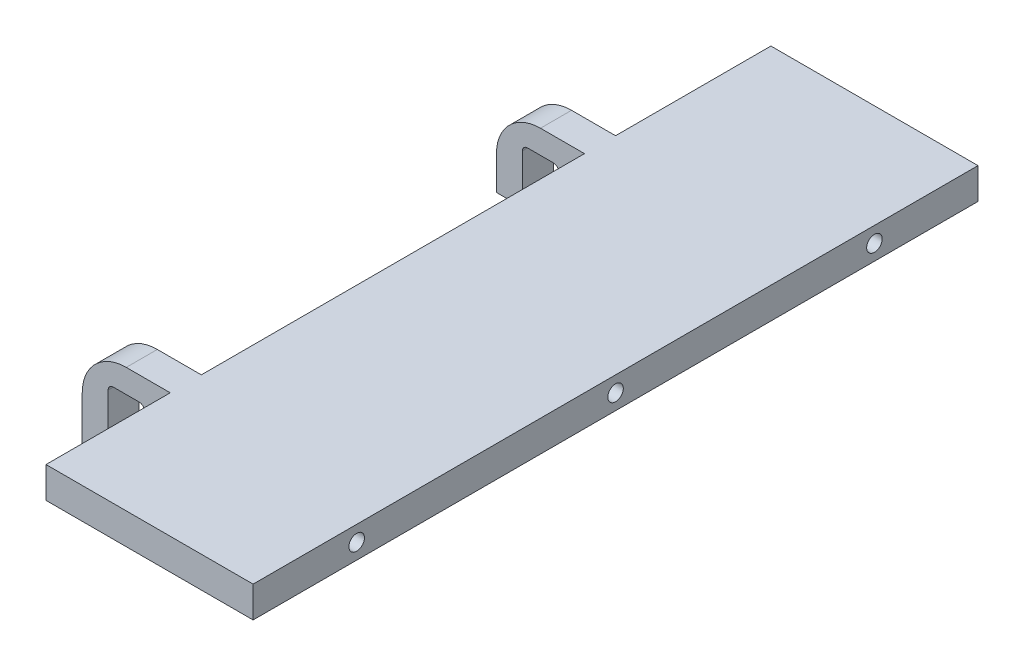
from build123d import *

# Parameters (mm, degrees)
BOSS_EXTRUDE1_DEPTH      = 3
LPATTERN1_COUNT          = 2
LPATTERN1_PITCH          = 40
SKETCH2_W                = 20
SKETCH2_H                = 70
BOSS_EXTRUDE2_DEPTH      = 3
FILLET1_R                = 3
BOSS_EXTRUDE3_DEPTH      = 3
FILLET2_START            = -1
FILLET2_DEPTH            = 5
FILLET3_DEPTH            = 3
BOSS_EXTRUDE5_REACH      = 65.784
BOSS_EXTRUDE5_END_RADIUS = 10.25
SKETCH5_R                = 1.5
LPATTERN2_START          = 7.5
LPATTERN2_OUTLINE_R      = 1.5
LPATTERN2_DEPTH          = 1.302234895
LPATTERN2_START_2        = 8.802234895
LPATTERN2_2_OUTLINE_R    = 1.5
LPATTERN2_2_DEPTH        = 2.539759791
LPATTERN2_START_3        = 39
LPATTERN2_3_DEPTH        = 5
LPATTERN2_4_OUTLINE_R    = 1.5
LPATTERN2_4_DEPTH        = 1.302235223
LPATTERN2_START_4        = 8.802235223
LPATTERN2_5_OUTLINE_R    = 1.5
LPATTERN2_5_DEPTH        = 2.539761855
LPATTERN2_6_OUTLINE_W    = 10.25
LPATTERN2_6_OUTLINE_H    = 3.000220265
LPATTERN2_6_ANGLE        = 22.115218
LPATTERN2_START_5        = 40
LPATTERN2_7_DEPTH        = 3
CUT_EXTRUDE2_DEPTH       = 64.922422006
CUT_EXTRUDE2_DEPTH_BACK  = 64.922422006
SKETCH6_W                = 3.5
SKETCH6_H                = 1.978060381
FILLET4_R                = 0.5
SKETCH7_W                = 2.5
SKETCH7_H                = 3
BOSS_EXTRUDE6_DEPTH      = 3
SKETCH8_R                = 0.75
CUT_EXTRUDE3_DEPTH       = 5
MIRROR1_START            = -4.25
MIRROR1_OUTLINE_W        = 20
MIRROR1_OUTLINE_H        = 3
MIRROR1_DEPTH            = 23.4999999
MIRROR1_START_2          = 20.75
MIRROR1_2_OUTLINE_W      = 20
MIRROR1_2_OUTLINE_H      = 3
MIRROR1_2_DEPTH          = 23.4999999
MIRROR1_START_3          = 45.75
MIRROR1_3_OUTLINE_W      = 20
MIRROR1_3_OUTLINE_H      = 3
MIRROR1_3_DEPTH          = 9.25
MIRROR1_START_4          = -15
MIRROR1_4_OUTLINE_W      = 20
MIRROR1_4_OUTLINE_H      = 3
MIRROR1_4_DEPTH          = 9.2499999
MIRROR1_START_5          = 40
MIRROR1_5_DEPTH          = 3
MIRROR1_6_DEPTH          = 3
MIRROR1_START_6          = 11
MIRROR1_7_OUTLINE_W      = 3
MIRROR1_7_OUTLINE_H      = 1.5000001
MIRROR1_7_DEPTH          = 15
MIRROR1_START_7          = 26
MIRROR1_8_DEPTH          = 5
MIRROR1_START_8          = 7.5
MIRROR1_9_OUTLINE_R      = 1.5
MIRROR1_9_DEPTH          = 1.302234895
MIRROR1_START_9          = 8.802234895
MIRROR1_10_OUTLINE_R     = 1.5
MIRROR1_10_DEPTH         = 2.539759791
MIRROR1_START_10         = -1
MIRROR1_11_DEPTH         = 5
MIRROR1_12_OUTLINE_R     = 1.5
MIRROR1_12_DEPTH         = 1.302235223
MIRROR1_START_11         = 8.802235223
MIRROR1_13_OUTLINE_R     = 1.5
MIRROR1_13_DEPTH         = 2.539761855
MIRROR1_14_OUTLINE_W     = 10.25
MIRROR1_14_OUTLINE_H     = 3.000220265
MIRROR1_14_ANGLE         = 22.115218
MIRROR1_15_DEPTH         = 3
MIRROR1_16_OUTLINE_R     = 1.5
MIRROR1_16_DEPTH         = 1.302234895
MIRROR1_17_OUTLINE_R     = 1.5
MIRROR1_17_DEPTH         = 2.539759791
MIRROR1_START_12         = 39
MIRROR1_18_DEPTH         = 5
MIRROR1_19_DEPTH         = 3
MIRROR1_20_OUTLINE_R     = 1.5
MIRROR1_20_DEPTH         = 1.302235223
MIRROR1_21_OUTLINE_R     = 1.5
MIRROR1_21_DEPTH         = 2.539761855
MIRROR1_22_OUTLINE_W     = 10.25
MIRROR1_22_OUTLINE_H     = 3.000220265
MIRROR1_22_ANGLE         = 22.115218
CUT_EXTRUDE4_DEPTH       = 82.052921206
CUT_EXTRUDE4_DEPTH_BACK  = 82.052921206
SKETCH9_W                = 31.619894417
SKETCH9_H                = 19.739229587


with BuildPart() as part:
    # Sketch1 → Boss-Extrude1 (new body)
    with BuildSketch(Plane.XY):
        with BuildLine():
            Line((0, 3.25), (0, 0))
            Line((0, 0), (2.5, 0))
            Line((2.5, 0), (2.5, 3.25))
            ThreePointArc((2.5, 3.25), (1.25520382, 6.25520382), (-1.75, 7.5))
            Line((-1.75, 7.5), (-6, 7.5))
            Line((-6, 7.5), (-6, 3.25))
            Line((-6, 3.25), (-6, 0))
            Line((-6, 0), (-3.5, 0))
            Line((-3.5, 0), (-3.5, 3.25))
            ThreePointArc((-3.5, 3.25), (-1.75, 5), (0, 3.25))
        make_face()
    extrude(amount=BOSS_EXTRUDE1_DEPTH)


with BuildPart() as lpattern1_1:
    # LPattern1: pattern copy
    add(part.part.moved(Location(Vector(0, 0, 1) * (1 * LPATTERN1_PITCH))))


with BuildPart() as part_1:
    add(part.part)

    add(lpattern1_1.part)  # Boss-Extrude2 merges LPattern1_1
    # Sketch2 → Boss-Extrude2 (add)
    with BuildSketch(Plane(origin=(0, 7.5, 0), x_dir=(1, 0, 0), z_dir=(0, 1, 0))):
        with Locations((-16, -20)):
            Rectangle(SKETCH2_W, SKETCH2_H)
    extrude(amount=-BOSS_EXTRUDE2_DEPTH)

    # Fillet1
    fillet1_edges = [part_1.edges().sort_by_distance(p)[0] for p in [
        (-6, 4.5, 1.5),
        (-6, 4.5, 41.5),
    ]]
    fillet(fillet1_edges, radius=FILLET1_R)

    # Sketch6 → Cut-Extrude2 (cut, two sides: drawn at the far end of the back side and taken through both)
    with BuildSketch(Plane.XY.offset(3).offset(-CUT_EXTRUDE2_DEPTH_BACK)):
        with Locations((-1.75, 4.239030191)):
            Rectangle(SKETCH6_W, SKETCH6_H)
    extrude(amount=CUT_EXTRUDE2_DEPTH + CUT_EXTRUDE2_DEPTH_BACK, mode=Mode.SUBTRACT)

    # Fillet4
    fillet4_edges = [part_1.edges().sort_by_distance(p)[0] for p in [
        (-3.5, 5.228060381, 1.5),
        (-3.5, 5.228060381, 41.5),
        (0, 5.228060381, 1.5),
        (0, 5.228060381, 41.5),
    ]]
    fillet(fillet4_edges, radius=FILLET4_R)

    # Sketch7 → Boss-Extrude6 (add)
    with BuildSketch(Plane.XY.offset(43)):
        with Locations((1.25, -1.5)):
            Rectangle(SKETCH7_W, SKETCH7_H)
    extrude(amount=-BOSS_EXTRUDE6_DEPTH)

    # Sketch8 → Cut-Extrude3 (cut)
    with BuildSketch(Plane.ZY.offset(26)):
        with Locations((-5, 6)):
            Circle(SKETCH8_R)
        with Locations((20, 6)):
            Circle(SKETCH8_R)
        with Locations((45, 6)):
            Circle(SKETCH8_R)
    extrude(amount=-CUT_EXTRUDE3_DEPTH, mode=Mode.SUBTRACT)


with BuildPart() as body_2:
    # Sketch4 → Boss-Extrude3 (new body)
    with BuildSketch(Plane.XY.offset(3)):
        with BuildLine():
            Line((-20.857798696, 25.621740076), (-21.206324936, 26.579308051))
            ThreePointArc((-21.206324936, 26.579308051), (-16.672163531, 7.522062955), (-9.682947675, 25.822010278))
            Line((-9.682947675, 25.822010278), (-10.11803023, 24.888972729))
            ThreePointArc((-10.11803023, 24.888972729), (-16.629657521, 8.521455618), (-20.857798696, 25.621740076))
        make_face()
    extrude(amount=-BOSS_EXTRUDE3_DEPTH)

    # Fillet2: read off the stored shape, not the designer's step
    # Fillet2 outline → Fillet2 (cut)
    with BuildSketch(Plane.XY.offset(FILLET2_START)):
        with BuildLine():
            add(Edge.make_bspline(
                [(-20.994076432, 25.996160077), (-21.074153595, 26.216170321), (-21.251523965, 26.350710286), (-21.454646821, 26.373043505), (-21.624101617, 26.320471493), (-21.744123922, 26.239260296)],
                knots=[0.438237279, 0.438237279, 0.438237279, 0.438237279, 0.438237279, 0.438237279, 1, 1, 1, 1, 1, 1], degree=5, weights=[0.507629267, 0.479872472, 0.515231147, 0.613705294, 0.775294911, 1]))
            Line((-20.994076432, 25.996160077), (-21.206324936, 26.579308051))
            ThreePointArc((-21.206324936, 26.579308051), (-21.477863695, 26.413458278), (-21.744123922, 26.239260296))
        make_face()
        with BuildLine():
            add(Edge.make_bspline(
                [(-21.183721588, 25.411039779), (-21.095700521, 25.470597844), (-21.011417818, 25.561339411), (-20.949957611, 25.687250869), (-20.937439038, 25.840550084), (-20.994076432, 25.996160077)],
                knots=[0, 0, 0, 0, 0, 0, 0.438237279, 0.438237279, 0.438237279, 0.438237279, 0.438237279, 0.438237279], degree=5, weights=[1, 0.824705088, 0.687820559, 0.589346413, 0.529282649, 0.507629267]))
            ThreePointArc((-21.183721588, 25.411039779), (-21.021865296, 25.518099442), (-20.857798696, 25.621740076))
            Line((-20.857798696, 25.621740076), (-20.994076432, 25.996160077))
        make_face()
    extrude(amount=FILLET2_DEPTH, mode=Mode.SUBTRACT)

    # Fillet3: read off the stored shape, not the designer's step
    # Fillet3 outline → Fillet3 (cut)
    with BuildSketch(Plane.XY):
        with BuildLine():
            add(Edge.make_bspline(
                [(-9.171518011, 25.394235327), (-9.282578146, 25.493443697), (-9.44922289, 25.569577268), (-9.660410728, 25.570842005), (-9.856114015, 25.450653826), (-9.957768573, 25.23265496)],
                knots=[0, 0, 0, 0, 0, 0, 0.573717386, 0.573717386, 0.573717386, 0.573717386, 0.573717386, 0.573717386], degree=5, weights=[1, 0.770513046, 0.606856419, 0.50903012, 0.477034149, 0.510868506]))
            ThreePointArc((-9.171518011, 25.394235327), (-9.423753658, 25.612282369), (-9.682947675, 25.822010278))
            Line((-9.682947675, 25.822010278), (-9.957768573, 25.23265496))
        make_face()
        with BuildLine():
            add(Edge.make_bspline(
                [(-9.957768573, 25.23265496), (-10.024989519, 25.088499201), (-10.028130695, 24.940896848), (-9.983698166, 24.813907164), (-9.914364214, 24.716929113), (-9.837711376, 24.648456271)],
                knots=[0.573717386, 0.573717386, 0.573717386, 0.573717386, 0.573717386, 0.573717386, 1, 1, 1, 1, 1, 1], degree=5, weights=[0.510868506, 0.536008058, 0.597490983, 0.695317282, 0.829486954, 1]))
            Line((-9.957768573, 25.23265496), (-10.11803023, 24.888972729))
            ThreePointArc((-10.11803023, 24.888972729), (-9.976670181, 24.770113809), (-9.837711376, 24.648456271))
        make_face()
    extrude(amount=FILLET3_DEPTH, mode=Mode.SUBTRACT)


with BuildPart() as body_3:
    # Boss-Extrude5: up to this cylinder (the profile starts outside it)
    boss_extrude5_end = Plane(origin=(-16, 17.75, 1.5), z_dir=(0, 0, 1)) * Cylinder(BOSS_EXTRUDE5_END_RADIUS, 153.068, mode=Mode.PRIVATE)
    # Sketch5 → Boss-Extrude5 (new, up to the surface)
    with BuildSketch(Plane(origin=(0, 7.5, 0), x_dir=(1, 0, 0), z_dir=(0, 1, 0)), mode=Mode.PRIVATE) as boss_extrude5_sk1:
        with Locations(Location((-22.5, -1.5, 0), (0, 0, 90))):
            Circle(SKETCH5_R)
    boss_extrude5_tool1 = extrude(boss_extrude5_sk1.sketch, amount=BOSS_EXTRUDE5_REACH, mode=Mode.PRIVATE) - boss_extrude5_end
    add(boss_extrude5_tool1.solids().sort_by_distance((-22.5, 7.5, 1.5))[0])
    # Sketch5 → Boss-Extrude5 (new, up to the surface)
    with BuildSketch(Plane(origin=(0, 7.5, 0), x_dir=(1, 0, 0), z_dir=(0, 1, 0)), mode=Mode.PRIVATE) as boss_extrude5_sk2:
        with Locations(Location((-9.5, -1.5, 0), (0, 0, 90))):
            Circle(SKETCH5_R)
    boss_extrude5_tool2 = extrude(boss_extrude5_sk2.sketch, amount=BOSS_EXTRUDE5_REACH, mode=Mode.PRIVATE) - boss_extrude5_end
    add(boss_extrude5_tool2.solids().sort_by_distance((-9.5, 7.5, 1.5))[0])


with BuildPart() as body_4:
    # LPattern2: read off the stored shape, not the designer's step
    # LPattern2 outline → LPattern2 (new body)
    with BuildSketch(Plane(origin=(0, 0, 0), x_dir=(1, 0, 0), z_dir=(0, 1, 0)).offset(LPATTERN2_START)):
        with Locations((-22.5, -41.5)):
            Circle(LPATTERN2_OUTLINE_R)
    extrude(amount=LPATTERN2_DEPTH)

    # LPattern2 2 outline → LPattern2 2 (add)
    with BuildSketch(Plane(origin=(0, 0, 0), x_dir=(1, 0, 0), z_dir=(0, 1, 0)).offset(LPATTERN2_START_2)):
        with Locations((-22.5, -41.5)):
            Circle(LPATTERN2_2_OUTLINE_R)
    extrude(amount=LPATTERN2_2_DEPTH)

    # LPattern2 3 outline → LPattern2 3 (cut)
    with BuildSketch(Plane.XY.offset(LPATTERN2_START_3)):
        with BuildLine():
            Line((-20, 11.341994686), (-23.999998778, 11.341995665))
            ThreePointArc((-23.999998778, 11.341995665), (-22.622702211, 9.926809128), (-20.999584885, 8.802002963))
            Line((-20.999584885, 8.802002963), (-20, 8.243497024))
            Line((-20, 8.243497024), (-20, 11.341994686))
        make_face()
    extrude(amount=LPATTERN2_3_DEPTH, mode=Mode.SUBTRACT)


with BuildPart() as body_5:
    # LPattern2 4 outline → LPattern2 4 (new body)
    with BuildSketch(Plane(origin=(0, 0, 0), x_dir=(1, 0, 0), z_dir=(0, 1, 0)).offset(LPATTERN2_START)):
        with Locations((-9.5, -41.5)):
            Circle(LPATTERN2_4_OUTLINE_R)
    extrude(amount=LPATTERN2_4_DEPTH)

    # LPattern2 5 outline → LPattern2 5 (add)
    with BuildSketch(Plane(origin=(0, 0, 0), x_dir=(1, 0, 0), z_dir=(0, 1, 0)).offset(LPATTERN2_START_4)):
        with Locations((-9.5, -41.5)):
            Circle(LPATTERN2_5_OUTLINE_R)
    extrude(amount=LPATTERN2_5_DEPTH)

    # LPattern2 6 outline → LPattern2 6 (revolve, cut)
    with BuildSketch(Plane(origin=(-16, 17.75, 0), x_dir=(0.4877650283417417, -0.8729749579035929, 0), z_dir=(-0.8729749579035929, -0.4877650283417417, 0))):
        with Locations((5.125, 41.500109978)):
            Rectangle(LPATTERN2_6_OUTLINE_W, LPATTERN2_6_OUTLINE_H)
    revolve(axis=Axis((-16, 17.75, 0), (0, 0, 1)), revolution_arc=LPATTERN2_6_ANGLE, mode=Mode.SUBTRACT)


with BuildPart() as body_6:
    # LPattern2 7 outline → LPattern2 7 (new body)
    with BuildSketch(Plane.XY.offset(LPATTERN2_START_5)):
        with BuildLine():
            ThreePointArc((-21.744123922, 26.239260296), (-16.687368099, 7.523073526), (-9.171518011, 25.394235327))
            add(Edge.make_bspline(
                [(-9.171518011, 25.394235327), (-9.42011103, 25.616299782), (-9.897400645, 25.707435586), (-10.230497327, 25.334546058), (-10.086304395, 24.870520725), (-9.837711376, 24.648456271)],
                knots=[0, 0, 0, 0, 0, 0, 1, 1, 1, 1, 1, 1], degree=5, weights=[1, 0.6, 0.4, 0.4, 0.6, 1]))
            ThreePointArc((-9.837711376, 24.648456271), (-16.620307797, 8.520822451), (-21.183721588, 25.41103978))
            add(Edge.make_bspline(
                [(-21.183721588, 25.41103978), (-20.907648082, 25.597840557), (-20.702656783, 26.038396659), (-20.98285795, 26.452506918), (-21.468050416, 26.426061074), (-21.744123922, 26.239260296)],
                knots=[0, 0, 0, 0, 0, 0, 1, 1, 1, 1, 1, 1], degree=5, weights=[1, 0.6, 0.4, 0.4, 0.6, 1]))
        make_face()
    extrude(amount=LPATTERN2_7_DEPTH)


with BuildPart() as body_7:
    # Mirror1: read off the stored shape, not the designer's step
    # Mirror1 outline → Mirror1 (new body)
    with BuildSketch(Plane.XY.offset(MIRROR1_START)):
        with Locations((21, 6)):
            Rectangle(MIRROR1_OUTLINE_W, MIRROR1_OUTLINE_H)
    extrude(amount=MIRROR1_DEPTH)

    # Mirror1 2 outline → Mirror1 2 (add)
    with BuildSketch(Plane.XY.offset(MIRROR1_START_2)):
        with Locations((21, 6)):
            Rectangle(MIRROR1_2_OUTLINE_W, MIRROR1_2_OUTLINE_H)
    extrude(amount=MIRROR1_2_DEPTH)

    # Mirror1 3 outline → Mirror1 3 (add)
    with BuildSketch(Plane.XY.offset(MIRROR1_START_3)):
        with Locations((21, 6)):
            Rectangle(MIRROR1_3_OUTLINE_W, MIRROR1_3_OUTLINE_H)
    extrude(amount=MIRROR1_3_DEPTH)

    # Mirror1 4 outline → Mirror1 4 (add)
    with BuildSketch(Plane.XY.offset(MIRROR1_START_4)):
        with Locations((21, 6)):
            Rectangle(MIRROR1_4_OUTLINE_W, MIRROR1_4_OUTLINE_H)
    extrude(amount=MIRROR1_4_DEPTH)

    # Mirror1 5 outline → Mirror1 5 (add)
    with BuildSketch(Plane.XY.offset(MIRROR1_START_5)):
        with BuildLine():
            Line((11, 4.5), (11, 7.5))
            Line((11, 7.5), (6.75, 7.5))
            ThreePointArc((6.75, 7.5), (3.74479618, 6.25520382), (2.5, 3.25))
            Line((2.5, 3.25), (2.5, -3))
            Line((2.5, -3), (5, -3))
            Line((5, -3), (5, 4.728060381))
            ThreePointArc((5, 4.728060381), (5.146446609, 5.081613772), (5.5, 5.228060381))
            Line((5.5, 5.228060381), (8, 5.228060381))
            ThreePointArc((8, 5.228060381), (8.353553391, 5.081613772), (8.5, 4.728060381))
            Line((8.5, 4.728060381), (8.5, 0))
            Line((8.5, 0), (11, 0))
            Line((11, 0), (11, 1.5))
            ThreePointArc((11, 1.5), (11.878679656, 3.621320344), (14, 4.5))
            Line((14, 4.5), (11, 4.5))
        make_face()
    extrude(amount=MIRROR1_5_DEPTH)

    # Mirror1 6 outline → Mirror1 6 (add)
    with BuildSketch(Plane.XY):
        with BuildLine():
            Line((11, 4.5), (11, 7.5))
            Line((11, 7.5), (6.75, 7.5))
            ThreePointArc((6.75, 7.5), (3.74479618, 6.25520382), (2.5, 3.25))
            Line((2.5, 3.25), (2.5, 0))
            Line((2.5, 0), (5, 0))
            Line((5, 0), (5, 4.728060381))
            ThreePointArc((5, 4.728060381), (5.146446609, 5.081613772), (5.5, 5.228060381))
            Line((5.5, 5.228060381), (8, 5.228060381))
            ThreePointArc((8, 5.228060381), (8.353553391, 5.081613772), (8.5, 4.728060381))
            Line((8.5, 4.728060381), (8.5, 0))
            Line((8.5, 0), (11, 0))
            Line((11, 0), (11, 1.5))
            ThreePointArc((11, 1.5), (11.878679656, 3.621320344), (14, 4.5))
            Line((14, 4.5), (11, 4.5))
        make_face()
    extrude(amount=MIRROR1_6_DEPTH)

    # Mirror1 7 outline → Mirror1 7 (add)
    with BuildSketch(Plane.YZ.offset(MIRROR1_START_6)):
        with Locations((6, -5.00000005)):
            Rectangle(MIRROR1_7_OUTLINE_W, MIRROR1_7_OUTLINE_H)
        with Locations((6, 19.99999995)):
            Rectangle(MIRROR1_7_OUTLINE_W, MIRROR1_7_OUTLINE_H)
        with Locations((6, 44.99999995)):
            Rectangle(MIRROR1_7_OUTLINE_W, MIRROR1_7_OUTLINE_H)
    extrude(amount=MIRROR1_7_DEPTH)

    # Mirror1 8 outline → Mirror1 8 (add)
    with BuildSketch(Plane.YZ.offset(MIRROR1_START_7)):
        with BuildLine():
            Line((6, -5.75), (7.5, -5.7500001))
            Line((7.5, -5.7500001), (7.5, -4.25))
            Line((7.5, -4.25), (6, -4.25))
            ThreePointArc((6, -4.25), (6.75, -5), (6, -5.75))
        make_face()
        with BuildLine():
            Line((4.5, -5.7500001), (6, -5.75))
            ThreePointArc((6, -5.75), (5.25, -5), (6, -4.25))
            Line((6, -4.25), (4.5, -4.25))
            Line((4.5, -4.25), (4.5, -5.7500001))
        make_face()
        with BuildLine():
            Line((6, 19.25), (7.5, 19.2499999))
            Line((7.5, 19.2499999), (7.5, 20.75))
            Line((7.5, 20.75), (6, 20.75))
            ThreePointArc((6, 20.75), (6.75, 20), (6, 19.25))
        make_face()
        with BuildLine():
            Line((4.5, 19.2499999), (6, 19.25))
            ThreePointArc((6, 19.25), (5.25, 20), (6, 20.75))
            Line((6, 20.75), (4.5, 20.75))
            Line((4.5, 20.75), (4.5, 19.2499999))
        make_face()
        with BuildLine():
            Line((6, 44.25), (7.5, 44.2499999))
            Line((7.5, 44.2499999), (7.5, 45.75))
            Line((7.5, 45.75), (6, 45.75))
            ThreePointArc((6, 45.75), (6.75, 45), (6, 44.25))
        make_face()
        with BuildLine():
            Line((4.5, 44.2499999), (6, 44.25))
            ThreePointArc((6, 44.25), (5.25, 45), (6, 45.75))
            Line((6, 45.75), (4.5, 45.75))
            Line((4.5, 45.75), (4.5, 44.2499999))
        make_face()
    extrude(amount=MIRROR1_8_DEPTH)


with BuildPart() as body_8:
    # Mirror1 9 outline → Mirror1 9 (new body)
    with BuildSketch(Plane(origin=(0, 0, 0), x_dir=(1, 0, 0), z_dir=(0, 1, 0)).offset(MIRROR1_START_8)):
        with Locations((27.5, -1.5)):
            Circle(MIRROR1_9_OUTLINE_R)
    extrude(amount=MIRROR1_9_DEPTH)

    # Mirror1 10 outline → Mirror1 10 (add)
    with BuildSketch(Plane(origin=(0, 0, 0), x_dir=(1, 0, 0), z_dir=(0, 1, 0)).offset(MIRROR1_START_9)):
        with Locations((27.5, -1.5)):
            Circle(MIRROR1_10_OUTLINE_R)
    extrude(amount=MIRROR1_10_DEPTH)

    # Mirror1 11 outline → Mirror1 11 (cut)
    with BuildSketch(Plane.XY.offset(MIRROR1_START_10)):
        with BuildLine():
            Line((25, 8.243497024), (25.999584885, 8.802002963))
            ThreePointArc((25.999584885, 8.802002963), (27.622702211, 9.926809128), (28.999998778, 11.341995665))
            Line((28.999998778, 11.341995665), (25, 11.341994686))
            Line((25, 11.341994686), (25, 8.243497024))
        make_face()
    extrude(amount=MIRROR1_11_DEPTH, mode=Mode.SUBTRACT)


with BuildPart() as body_9:
    # Mirror1 12 outline → Mirror1 12 (new body)
    with BuildSketch(Plane(origin=(0, 0, 0), x_dir=(1, 0, 0), z_dir=(0, 1, 0)).offset(MIRROR1_START_8)):
        with Locations((14.5, -41.5)):
            Circle(MIRROR1_12_OUTLINE_R)
    extrude(amount=MIRROR1_12_DEPTH)

    # Mirror1 13 outline → Mirror1 13 (add)
    with BuildSketch(Plane(origin=(0, 0, 0), x_dir=(1, 0, 0), z_dir=(0, 1, 0)).offset(MIRROR1_START_11)):
        with Locations((14.5, -41.5)):
            Circle(MIRROR1_13_OUTLINE_R)
    extrude(amount=MIRROR1_13_DEPTH)

    # Mirror1 14 outline → Mirror1 14 (revolve, cut)
    with BuildSketch(Plane(origin=(21, 17.75, 0), x_dir=(-0.7805286813468162, -0.6251199705616516, 0), z_dir=(-0.6251199705616516, 0.7805286813468162, 0))):
        with Locations((5.125, 41.500109978)):
            Rectangle(MIRROR1_14_OUTLINE_W, MIRROR1_14_OUTLINE_H)
    revolve(axis=Axis((21, 17.75, 0), (0, 0, 1)), revolution_arc=MIRROR1_14_ANGLE, mode=Mode.SUBTRACT)


with BuildPart() as body_10:
    # Mirror1 15 outline → Mirror1 15 (new body)
    with BuildSketch(Plane.XY.offset(MIRROR1_START_5)):
        with BuildLine():
            add(Edge.make_bspline(
                [(14.171518011, 25.394235327), (14.42011103, 25.616299782), (14.897400645, 25.707435586), (15.230497327, 25.334546058), (15.086304395, 24.870520725), (14.837711376, 24.648456271)],
                knots=[0, 0, 0, 0, 0, 0, 1, 1, 1, 1, 1, 1], degree=5, weights=[1, 0.6, 0.4, 0.4, 0.6, 1]))
            ThreePointArc((14.171518011, 25.394235327), (21.687368099, 7.523073526), (26.744123922, 26.239260296))
            add(Edge.make_bspline(
                [(26.183721588, 25.411039779), (25.907648082, 25.597840557), (25.702656783, 26.038396659), (25.98285795, 26.452506918), (26.468050416, 26.426061074), (26.744123922, 26.239260296)],
                knots=[0, 0, 0, 0, 0, 0, 1, 1, 1, 1, 1, 1], degree=5, weights=[1, 0.6, 0.4, 0.4, 0.6, 1]))
            ThreePointArc((26.183721588, 25.411039779), (21.620307797, 8.520822451), (14.837711376, 24.648456271))
        make_face()
    extrude(amount=MIRROR1_15_DEPTH)


with BuildPart() as body_11:
    # Mirror1 16 outline → Mirror1 16 (new body)
    with BuildSketch(Plane(origin=(0, 0, 0), x_dir=(1, 0, 0), z_dir=(0, 1, 0)).offset(MIRROR1_START_8)):
        with Locations((27.5, -41.5)):
            Circle(MIRROR1_16_OUTLINE_R)
    extrude(amount=MIRROR1_16_DEPTH)

    # Mirror1 17 outline → Mirror1 17 (add)
    with BuildSketch(Plane(origin=(0, 0, 0), x_dir=(1, 0, 0), z_dir=(0, 1, 0)).offset(MIRROR1_START_9)):
        with Locations((27.5, -41.5)):
            Circle(MIRROR1_17_OUTLINE_R)
    extrude(amount=MIRROR1_17_DEPTH)

    # Mirror1 18 outline → Mirror1 18 (cut)
    with BuildSketch(Plane.XY.offset(MIRROR1_START_12)):
        with BuildLine():
            Line((25, 8.243497024), (25.999584885, 8.802002963))
            ThreePointArc((25.999584885, 8.802002963), (27.622702211, 9.926809128), (28.999998778, 11.341995665))
            Line((28.999998778, 11.341995665), (25, 11.341994686))
            Line((25, 11.341994686), (25, 8.243497024))
        make_face()
    extrude(amount=MIRROR1_18_DEPTH, mode=Mode.SUBTRACT)


with BuildPart() as body_12:
    # Mirror1 19 outline → Mirror1 19 (new body)
    with BuildSketch(Plane.XY):
        with BuildLine():
            add(Edge.make_bspline(
                [(14.171518011, 25.394235327), (14.42011103, 25.616299782), (14.897400645, 25.707435586), (15.230497327, 25.334546058), (15.086304395, 24.870520725), (14.837711376, 24.648456271)],
                knots=[0, 0, 0, 0, 0, 0, 1, 1, 1, 1, 1, 1], degree=5, weights=[1, 0.6, 0.4, 0.4, 0.6, 1]))
            ThreePointArc((14.171518011, 25.394235327), (21.687368099, 7.523073526), (26.744123922, 26.239260296))
            add(Edge.make_bspline(
                [(26.183721588, 25.411039779), (25.907648082, 25.597840557), (25.702656783, 26.038396659), (25.98285795, 26.452506918), (26.468050416, 26.426061074), (26.744123922, 26.239260296)],
                knots=[0, 0, 0, 0, 0, 0, 1, 1, 1, 1, 1, 1], degree=5, weights=[1, 0.6, 0.4, 0.4, 0.6, 1]))
            ThreePointArc((26.183721588, 25.411039779), (21.620307797, 8.520822451), (14.837711376, 24.648456271))
        make_face()
    extrude(amount=MIRROR1_19_DEPTH)


with BuildPart() as body_13:
    # Mirror1 20 outline → Mirror1 20 (new body)
    with BuildSketch(Plane(origin=(0, 0, 0), x_dir=(1, 0, 0), z_dir=(0, 1, 0)).offset(MIRROR1_START_8)):
        with Locations((14.5, -1.5)):
            Circle(MIRROR1_20_OUTLINE_R)
    extrude(amount=MIRROR1_20_DEPTH)

    # Mirror1 21 outline → Mirror1 21 (add)
    with BuildSketch(Plane(origin=(0, 0, 0), x_dir=(1, 0, 0), z_dir=(0, 1, 0)).offset(MIRROR1_START_11)):
        with Locations((14.5, -1.5)):
            Circle(MIRROR1_21_OUTLINE_R)
    extrude(amount=MIRROR1_21_DEPTH)

    # Mirror1 22 outline → Mirror1 22 (revolve, cut)
    with BuildSketch(Plane(origin=(21, 17.75, 0), x_dir=(-0.7805286813468165, -0.6251199705616513, 0), z_dir=(-0.6251199705616513, 0.7805286813468165, 0))):
        with Locations((5.125, 1.500109978)):
            Rectangle(MIRROR1_22_OUTLINE_W, MIRROR1_22_OUTLINE_H)
    revolve(axis=Axis((21, 17.75, 0), (0, 0, 1)), revolution_arc=MIRROR1_22_ANGLE, mode=Mode.SUBTRACT)


with BuildPart() as cut_extrude4_tool:
    # Sketch9 → Cut-Extrude4 (new, two sides: drawn at the far end of the back side and taken through both)
    with BuildSketch(Plane.XY.offset(55).offset(-CUT_EXTRUDE4_DEPTH_BACK)):
        with Locations((21.361201043, 17.369614794)):
            Rectangle(SKETCH9_W, SKETCH9_H)
    extrude(amount=CUT_EXTRUDE4_DEPTH + CUT_EXTRUDE4_DEPTH_BACK)


with BuildPart() as body_8_1:
    add(body_8.part)

    # Cut-Extrude4: cut by cut_extrude4_tool
    add(cut_extrude4_tool.part, mode=Mode.SUBTRACT)


with BuildPart() as body_9_1:
    add(body_9.part)

    # Cut-Extrude4: cut by cut_extrude4_tool
    add(cut_extrude4_tool.part, mode=Mode.SUBTRACT)


with BuildPart() as body_10_1:
    add(body_10.part)

    # Cut-Extrude4: cut by cut_extrude4_tool
    add(cut_extrude4_tool.part, mode=Mode.SUBTRACT)


with BuildPart() as body_11_1:
    add(body_11.part)

    # Cut-Extrude4: cut by cut_extrude4_tool
    add(cut_extrude4_tool.part, mode=Mode.SUBTRACT)


with BuildPart() as body_12_1:
    add(body_12.part)

    # Cut-Extrude4: cut by cut_extrude4_tool
    add(cut_extrude4_tool.part, mode=Mode.SUBTRACT)


with BuildPart() as body_13_1:
    add(body_13.part)

    # Cut-Extrude4: cut by cut_extrude4_tool
    add(cut_extrude4_tool.part, mode=Mode.SUBTRACT)


solid = body_7.part
